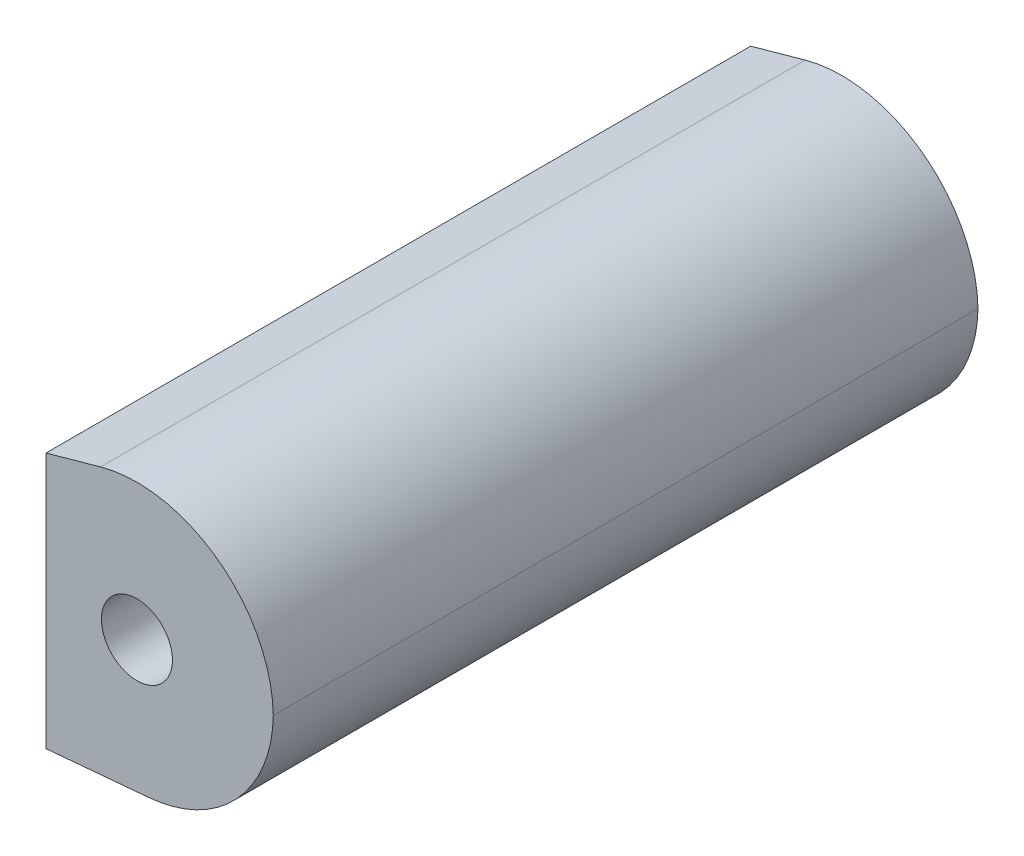
from build123d import *

# Parameters (mm, degrees)
SKETCH1_R               = 1.984375
BOSS_EXTRUDE1_DEPTH     = 39.37
CUT_EXTRUDE2_DEPTH      = 62.664828162
CUT_EXTRUDE2_DEPTH_BACK = 62.664828162
SKETCH3_W               = 64.931431167
SKETCH3_H               = 41.251540677


with BuildPart() as part:
    # Sketch1 → Boss-Extrude1 (new body)
    with BuildSketch(Plane.XY):
        with BuildLine():
            ThreePointArc((20.568025107, -2.262743193), (25.492605461, 0.119444869), (27.551899423, 5.187543131))
            ThreePointArc((27.551899423, 5.187543131), (24.489282859, 11.152254923), (17.899072442, 12.38778462))
            add(Edge.make_bspline(
                [(17.899072442, 12.38778462), (11.779016726, 10.69250234), (-2.958574168, 6.431868525), (-24.080278159, -0.407648755), (-34.99363821, -4.735815006), (-48.537358713, -9.634849887), (-43.566754384, -9.118513058)],
                knots=[0, 0, 0, 0, 0.056261028, 0.133578719, 0.179880978, 0.203822749, 0.203822749, 0.203822749, 0.203822749], degree=3))
            add(Edge.make_bspline(
                [(-43.566754384, -9.118513058), (-37.677273054, -7.647687935), (-27.709948033, -7.024655832), (-9.984463479, -4.604286441), (5.433214693, -3.691229751), (16.924119008, -2.567827505), (20.534293367, -2.265562996), (20.568025107, -2.262743193)],
                knots=[0.794337025, 0.794337025, 0.794337025, 0.794337025, 0.852124106, 0.889611916, 0.965358143, 0.999676327, 1, 1, 1, 1], degree=3))
        make_face()
        with Locations((19.933245616, 5.044315447)):
            Circle(SKETCH1_R, mode=Mode.SUBTRACT)
    extrude(amount=BOSS_EXTRUDE1_DEPTH)

    # Sketch3 → Cut-Extrude2 (cut, two sides: drawn at the far end of the back side and taken through both)
    with BuildSketch(Plane.XY.offset(39.37).offset(-CUT_EXTRUDE2_DEPTH_BACK)):
        with Locations((-17.613816161, 2.606074021)):
            Rectangle(SKETCH3_W, SKETCH3_H)
    extrude(amount=CUT_EXTRUDE2_DEPTH + CUT_EXTRUDE2_DEPTH_BACK, mode=Mode.SUBTRACT)


solid = part.part
